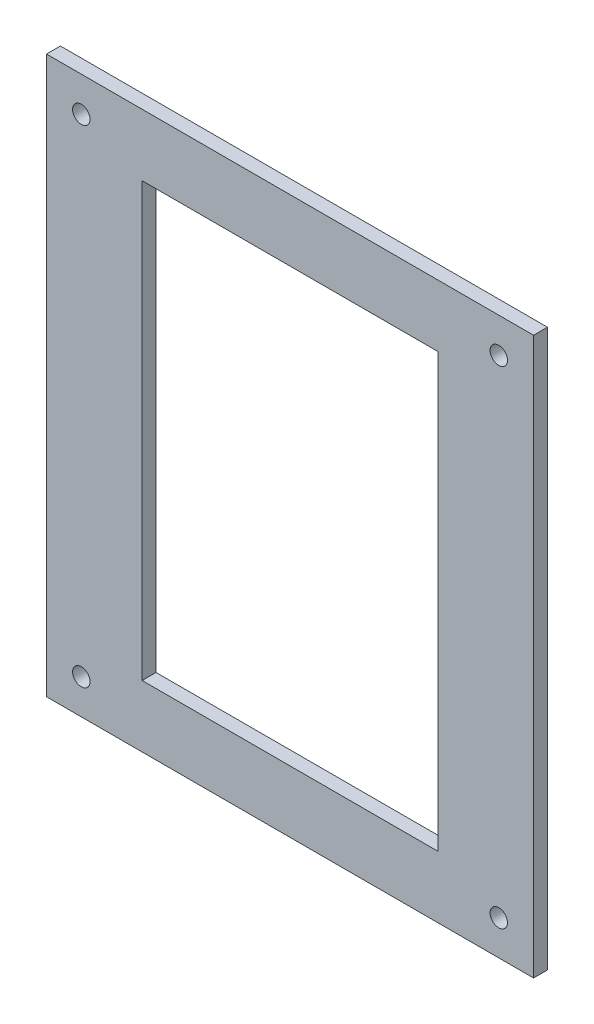
from build123d import *

# Parameters (mm, degrees)
SKETCH1_W           = 88.9
SKETCH1_H           = 101.6
SKETCH1_R           = 1.59
SKETCH1_W_2         = 54
SKETCH1_H_2         = 79
BOSS_EXTRUDE1_DEPTH = 2.54


with BuildPart() as part:
    # Sketch1 → Boss-Extrude1 (new body)
    with BuildSketch(Plane.XY):
        with Locations((44.45, -50.8)):
            Rectangle(SKETCH1_W, SKETCH1_H)
        with Locations((6.35, -6.35)):
            Circle(SKETCH1_R, mode=Mode.SUBTRACT)
        with Locations((82.55, -6.35)):
            Circle(SKETCH1_R, mode=Mode.SUBTRACT)
        with Locations((82.55, -95.25)):
            Circle(SKETCH1_R, mode=Mode.SUBTRACT)
        with Locations((6.35, -95.25)):
            Circle(SKETCH1_R, mode=Mode.SUBTRACT)
        with Locations((44.45, -50.8)):
            Rectangle(SKETCH1_W_2, SKETCH1_H_2, mode=Mode.SUBTRACT)
    extrude(amount=BOSS_EXTRUDE1_DEPTH)


solid = part.part
